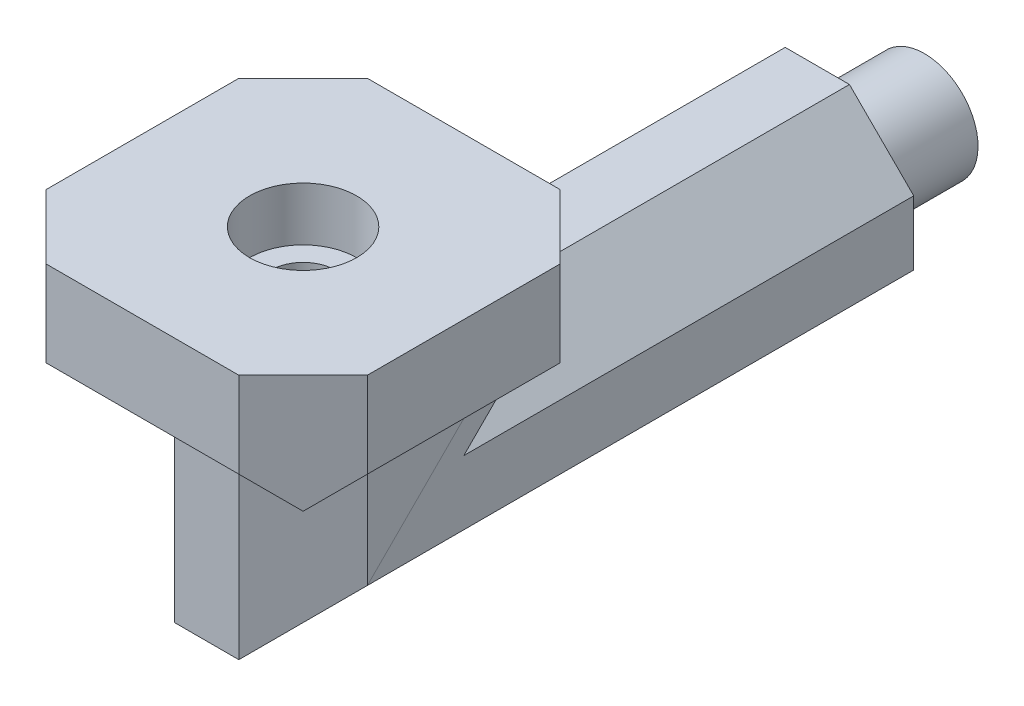
from build123d import *

# Parameters (mm, degrees)
SKETCH1_W                = 15
SKETCH1_H                = 15
SKETCH1_R                = 2.5
BOSS_EXTRUDE1_DEPTH      = 3
CHAMFER1_SIZE            = 3
SKETCH1_6_R              = 2.5
BOSS_EXTRUDE3_DEPTH      = 0.5
SKETCH18_W               = 9
SKETCH18_H               = 9
CHAMFER4_SIZE            = 4
CHAMFER5_SIZE            = 3
SKETCH19_OUTSIDE_W       = 25.408
SKETCH19_OUTSIDE_H       = 24.908
SKETCH19_OUTSIDE_R       = 2.5
CUT_EXTRUDE2_DEPTH       = 5
F_3_0_3_DIAMETER_HOLE1_D = 3


with BuildPart() as part:
    # Sketch1 → Boss-Extrude1 (new body)
    with BuildSketch(Plane(origin=(0, 0, 0), x_dir=(1, 0, 0), z_dir=(0, 1, 0))):
        Rectangle(SKETCH1_W, SKETCH1_H)
        with Locations(Location((0, 0, 0), (0, 0, 270))):
            Circle(SKETCH1_R, mode=Mode.SUBTRACT)
    extrude(amount=BOSS_EXTRUDE1_DEPTH)

    # Chamfer1
    chamfer1_edges = [part.edges().sort_by_distance(p)[0] for p in [
        (7.5, 1.5, 7.5),
        (-7.5, 1.5, 7.5),
        (-7.5, 1.5, -7.5),
        (7.5, 1.5, -7.5),
    ]]
    chamfer(chamfer1_edges, length=CHAMFER1_SIZE)

    # Sketch1<6> → Boss-Extrude3 (add)
    with BuildSketch(Plane(origin=(0, 0, 0), x_dir=(1, 0, 0), z_dir=(0, 1, 0))):
        with Locations(Location((0, 0, 0), (0, 0, 270))):
            Circle(SKETCH1_6_R)
    extrude(amount=BOSS_EXTRUDE3_DEPTH)

    # Sweep3: sweep along a path in Sketch2
    with BuildLine(Plane(origin=(0, 0, 0), x_dir=(0, 0, -1), z_dir=(1, 0, 0))) as sweep3_path:
        Line((0, 0), (0, -7))
        Line((0, -7), (29, -7))
    # Sketch18 → Sweep3 (sweep)
    with BuildSketch(Plane.XZ):
        Rectangle(SKETCH18_W, SKETCH18_H)
    sweep(path=sweep3_path.line, transition=Transition.RIGHT)

    # Chamfer4
    # the kernel refuses this chamfer: 4 mm, written as the material it adds along each edge
    with BuildSketch(Plane(origin=(-14.786731952, 0, -4.5), x_dir=(0, 0, -1), z_dir=(1, 0, 0))) as chamfer4_piece_1_section:
        Polygon((CHAMFER4_SIZE, 0), (0, -CHAMFER4_SIZE), (0, 0), align=None)
    chamfer4_piece_1 = extrude(amount=29.573463904, mode=Mode.PRIVATE)
    chamfer4_piece_1 = split(chamfer4_piece_1, bisect_by=Plane(origin=(-14.786731952, 0, -7.5), z_dir=(0, 0, 1)), keep=Keep.TOP, mode=Mode.PRIVATE)
    chamfer4_piece_1 = split(chamfer4_piece_1, bisect_by=Plane(origin=(-11.143365976, 0, -0.856634024), z_dir=(0.7071067811865476, 0, 0.7071067811865476)), keep=Keep.TOP, mode=Mode.PRIVATE)
    chamfer4_piece_1 = split(chamfer4_piece_1, bisect_by=Plane(origin=(-3.643365976, 0, -15.643365976), z_dir=(-0.7071067811865476, 0, 0.7071067811865476)), keep=Keep.TOP, mode=Mode.PRIVATE)
    chamfer4_piece_1 = split(chamfer4_piece_1, bisect_by=Plane(origin=(-11.643365976, 3.143365976, -4.5), z_dir=(0.7071067811865476, 0.7071067811865475, 0)), keep=Keep.TOP, mode=Mode.PRIVATE)
    chamfer4_piece_1 = split(chamfer4_piece_1, bisect_by=Plane(origin=(-3.143365976, -11.643365976, -4.5), z_dir=(-0.7071067811865476, 0.7071067811865475, 0)), keep=Keep.TOP, mode=Mode.PRIVATE)
    add(chamfer4_piece_1)
    with BuildSketch(Plane(origin=(4.5, 0, -14.786731952), x_dir=(1, 0, 0), z_dir=(0, 0, 1))) as chamfer4_piece_2_section:
        Polygon((CHAMFER4_SIZE, 0), (0, -CHAMFER4_SIZE), (0, 0), align=None)
    chamfer4_piece_2 = extrude(amount=29.573463904, mode=Mode.PRIVATE)
    chamfer4_piece_2 = split(chamfer4_piece_2, bisect_by=Plane(origin=(0.856634024, 0, -11.143365976), z_dir=(-0.7071067811865476, 0, 0.7071067811865476)), keep=Keep.TOP, mode=Mode.PRIVATE)
    chamfer4_piece_2 = split(chamfer4_piece_2, bisect_by=Plane(origin=(7.5, 0, -14.786731952), z_dir=(-1, 0, 0)), keep=Keep.TOP, mode=Mode.PRIVATE)
    chamfer4_piece_2 = split(chamfer4_piece_2, bisect_by=Plane(origin=(15.643365976, 0, -3.643365976), z_dir=(-0.7071067811865476, 0, -0.7071067811865476)), keep=Keep.TOP, mode=Mode.PRIVATE)
    chamfer4_piece_2 = split(chamfer4_piece_2, bisect_by=Plane(origin=(4.5, 3.143365976, -11.643365976), z_dir=(0, 0.7071067811865475, 0.7071067811865476)), keep=Keep.TOP, mode=Mode.PRIVATE)
    chamfer4_piece_2 = split(chamfer4_piece_2, bisect_by=Plane(origin=(4.5, -11.643365976, -3.143365976), z_dir=(0, 0.7071067811865477, -0.7071067811865475)), keep=Keep.TOP, mode=Mode.PRIVATE)
    add(chamfer4_piece_2)
    with BuildSketch(Plane(origin=(14.786731952, 0, 4.5), x_dir=(0, 0, 1), z_dir=(-1, 0, 0))) as chamfer4_piece_3_section:
        Polygon((CHAMFER4_SIZE, 0), (0, -CHAMFER4_SIZE), (0, 0), align=None)
    chamfer4_piece_3 = extrude(amount=29.573463904, mode=Mode.PRIVATE)
    chamfer4_piece_3 = split(chamfer4_piece_3, bisect_by=Plane(origin=(3.643365976, 0, 15.643365976), z_dir=(0.7071067811865476, 0, -0.7071067811865476)), keep=Keep.TOP, mode=Mode.PRIVATE)
    chamfer4_piece_3 = split(chamfer4_piece_3, bisect_by=Plane(origin=(11.143365976, 0, 0.856634024), z_dir=(-0.7071067811865476, 0, -0.7071067811865476)), keep=Keep.TOP, mode=Mode.PRIVATE)
    chamfer4_piece_3 = split(chamfer4_piece_3, bisect_by=Plane(origin=(14.786731952, 0, 7.5), z_dir=(0, 0, -1)), keep=Keep.TOP, mode=Mode.PRIVATE)
    chamfer4_piece_3 = split(chamfer4_piece_3, bisect_by=Plane(origin=(3.143365976, -11.643365976, 4.5), z_dir=(0.7071067811865476, 0.7071067811865475, 0)), keep=Keep.TOP, mode=Mode.PRIVATE)
    chamfer4_piece_3 = split(chamfer4_piece_3, bisect_by=Plane(origin=(11.643365976, 3.143365976, 4.5), z_dir=(-0.7071067811865476, 0.7071067811865475, 0)), keep=Keep.TOP, mode=Mode.PRIVATE)
    add(chamfer4_piece_3)
    with BuildSketch(Plane(origin=(-4.5, 0, 14.786731952), x_dir=(-1, 0, 0), z_dir=(0, 0, -1))) as chamfer4_piece_4_section:
        Polygon((CHAMFER4_SIZE, 0), (0, -CHAMFER4_SIZE), (0, 0), align=None)
    chamfer4_piece_4 = extrude(amount=29.573463904, mode=Mode.PRIVATE)
    chamfer4_piece_4 = split(chamfer4_piece_4, bisect_by=Plane(origin=(-15.643365976, 0, 3.643365976), z_dir=(0.7071067811865476, 0, 0.7071067811865476)), keep=Keep.TOP, mode=Mode.PRIVATE)
    chamfer4_piece_4 = split(chamfer4_piece_4, bisect_by=Plane(origin=(-7.5, 0, 14.786731952), z_dir=(1, 0, 0)), keep=Keep.TOP, mode=Mode.PRIVATE)
    chamfer4_piece_4 = split(chamfer4_piece_4, bisect_by=Plane(origin=(-0.856634024, 0, 11.143365976), z_dir=(0.7071067811865476, 0, -0.7071067811865476)), keep=Keep.TOP, mode=Mode.PRIVATE)
    chamfer4_piece_4 = split(chamfer4_piece_4, bisect_by=Plane(origin=(-4.5, -11.643365976, 3.143365976), z_dir=(0, 0.7071067811865475, 0.7071067811865476)), keep=Keep.TOP, mode=Mode.PRIVATE)
    chamfer4_piece_4 = split(chamfer4_piece_4, bisect_by=Plane(origin=(-4.5, 3.143365976, 11.643365976), z_dir=(0, 0.7071067811865477, -0.7071067811865475)), keep=Keep.TOP, mode=Mode.PRIVATE)
    add(chamfer4_piece_4)

    # Chamfer5
    # the kernel refuses this chamfer: 3 mm, written as the material it takes off along each edge
    with BuildSketch(Plane(origin=(4.5, -11.5, 12.215048964), x_dir=(-1, 0, 0), z_dir=(0, 0, -1))) as chamfer5_piece_1:
        Polygon((CHAMFER5_SIZE, 0), (0, CHAMFER5_SIZE), (0, 0), align=None)
    extrude(amount=48.930097928, mode=Mode.SUBTRACT)
    with BuildSketch(Plane(origin=(-4.5, -11.5, 12.215048964), x_dir=(1, 0, 0), z_dir=(0, 0, -1))) as chamfer5_piece_2:
        Polygon((CHAMFER5_SIZE, 0), (0, -CHAMFER5_SIZE), (0, 0), align=None)
    extrude(amount=48.930097928, mode=Mode.SUBTRACT)
    with BuildSketch(Plane(origin=(4.5, -2.5, 1.715048964), x_dir=(-1, 0, 0), z_dir=(0, 0, -1))) as chamfer5_piece_3_section:
        Polygon((CHAMFER5_SIZE, 0), (0, -CHAMFER5_SIZE), (0, 0), align=None)
    chamfer5_piece_3 = extrude(amount=38.430097928, mode=Mode.PRIVATE)
    chamfer5_piece_3 = split(chamfer5_piece_3, bisect_by=Plane(origin=(4.5, -6.357524482, -2.142475518), z_dir=(0, -0.7071067811865476, -0.7071067811865476)), keep=Keep.TOP, mode=Mode.PRIVATE)
    add(chamfer5_piece_3, mode=Mode.SUBTRACT)
    with BuildSketch(Plane(origin=(-4.5, -2.5, 1.715048964), x_dir=(1, 0, 0), z_dir=(0, 0, -1))) as chamfer5_piece_4_section:
        Polygon((CHAMFER5_SIZE, 0), (0, CHAMFER5_SIZE), (0, 0), align=None)
    chamfer5_piece_4 = extrude(amount=38.430097928, mode=Mode.PRIVATE)
    chamfer5_piece_4 = split(chamfer5_piece_4, bisect_by=Plane(origin=(-4.5, -6.357524482, -2.142475518), z_dir=(0, -0.7071067811865476, -0.7071067811865476)), keep=Keep.TOP, mode=Mode.PRIVATE)
    add(chamfer5_piece_4, mode=Mode.SUBTRACT)
    with BuildSketch(Plane(origin=(4.5, 3.715048964, 4.5), x_dir=(-1, 0, 0), z_dir=(0, -1, 0))) as chamfer5_piece_5_section:
        Polygon((CHAMFER5_SIZE, 0), (0, CHAMFER5_SIZE), (0, 0), align=None)
    chamfer5_piece_5 = extrude(amount=22.930097928, mode=Mode.PRIVATE)
    chamfer5_piece_5 = split(chamfer5_piece_5, bisect_by=Plane(origin=(8.357524482, -0.142475518, 4.5), z_dir=(0.7071067811865476, -0.7071067811865476, 0)), keep=Keep.TOP, mode=Mode.PRIVATE)
    add(chamfer5_piece_5, mode=Mode.SUBTRACT)
    with BuildSketch(Plane(origin=(4.5, 3.715048964, 4.5), x_dir=(-1, 0, 0), z_dir=(0, -1, 0))) as chamfer5_piece_6_section:
        Polygon((CHAMFER5_SIZE, 0), (0, CHAMFER5_SIZE), (0, 0), align=None)
    chamfer5_piece_6 = extrude(amount=22.930097928, mode=Mode.PRIVATE)
    chamfer5_piece_6 = split(chamfer5_piece_6, bisect_by=Plane(origin=(4.5, -0.142475518, 8.357524482), z_dir=(0, -0.7071067811865476, 0.7071067811865476)), keep=Keep.TOP, mode=Mode.PRIVATE)
    add(chamfer5_piece_6, mode=Mode.SUBTRACT)
    with BuildSketch(Plane(origin=(-4.5, 3.715048964, 4.5), x_dir=(1, 0, 0), z_dir=(0, -1, 0))) as chamfer5_piece_7_section:
        Polygon((CHAMFER5_SIZE, 0), (0, -CHAMFER5_SIZE), (0, 0), align=None)
    chamfer5_piece_7 = extrude(amount=22.930097928, mode=Mode.PRIVATE)
    chamfer5_piece_7 = split(chamfer5_piece_7, bisect_by=Plane(origin=(-8.357524482, -0.142475518, 4.5), z_dir=(-0.7071067811865476, -0.7071067811865476, 0)), keep=Keep.TOP, mode=Mode.PRIVATE)
    add(chamfer5_piece_7, mode=Mode.SUBTRACT)
    with BuildSketch(Plane(origin=(-4.5, 3.715048964, 4.5), x_dir=(1, 0, 0), z_dir=(0, -1, 0))) as chamfer5_piece_8_section:
        Polygon((CHAMFER5_SIZE, 0), (0, -CHAMFER5_SIZE), (0, 0), align=None)
    chamfer5_piece_8 = extrude(amount=22.930097928, mode=Mode.PRIVATE)
    chamfer5_piece_8 = split(chamfer5_piece_8, bisect_by=Plane(origin=(-4.5, -0.142475518, 8.357524482), z_dir=(0, -0.7071067811865476, 0.7071067811865476)), keep=Keep.TOP, mode=Mode.PRIVATE)
    add(chamfer5_piece_8, mode=Mode.SUBTRACT)

    # Sketch19 outside → Cut-Extrude2 (cut)
    with BuildSketch(Plane(origin=(0, 0, -29), x_dir=(-1, 0, 0), z_dir=(0, 0, -1))):
        with Locations((0, -4.25)):
            Rectangle(SKETCH19_OUTSIDE_W, SKETCH19_OUTSIDE_H)
        with Locations(Location((0, -7, 0), (0, 0, 90))):
            Circle(SKETCH19_OUTSIDE_R, mode=Mode.SUBTRACT)
    extrude(amount=-CUT_EXTRUDE2_DEPTH, mode=Mode.SUBTRACT)

    # Ø3.0 (3) Diameter Hole1 (through all)
    with Locations(Plane(origin=(0, 3, 0), x_dir=(1, 0, 0), z_dir=(0, 1, 0))):
        with Locations((0, 0)):
            Hole(F_3_0_3_DIAMETER_HOLE1_D / 2)


solid = part.part
